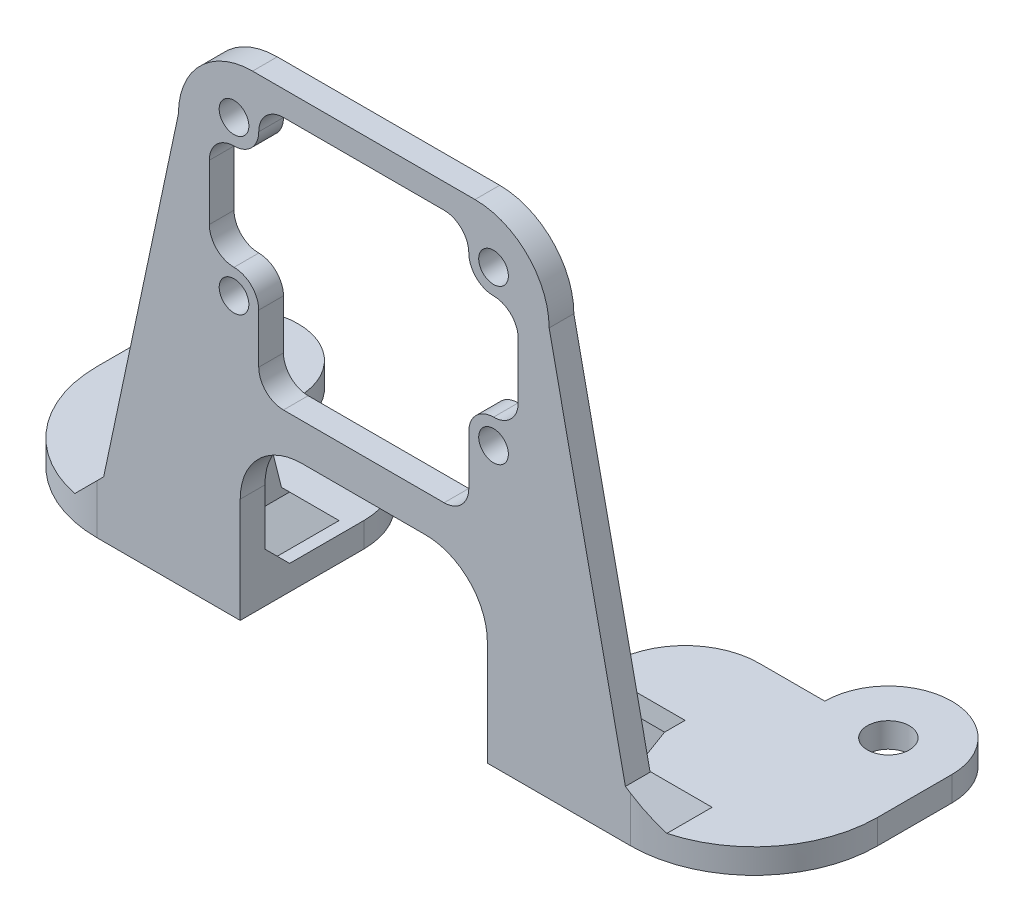
from build123d import *
from OCP.BRepFilletAPI import BRepFilletAPI_MakeChamfer

# Parameters (mm, degrees)
SKETCH1_R             = 1.7
BOSS_EXTRUDE1_DEPTH   = 2
SKETCH2_W             = 30
SKETCH2_H             = 2
BOSS_EXTRUDE2_DEPTH   = 35
CUT_EXTRUDE1_DEPTH    = 2
SKETCH5_W             = 17
SKETCH5_H             = 15.5
CUT_EXTRUDE2_DEPTH    = 2
SKETCH6_R             = 1.2
CUT_EXTRUDE3_DEPTH    = 2
BOSS_EXTRUDE4_START   = -2
SKETCH7_W             = 30
SKETCH7_H             = 2
BOSS_EXTRUDE4_DEPTH   = 2
SKETCH8_W             = 20
SKETCH8_H             = 3
CUT_EXTRUDE4_DEPTH    = 2
SKETCH9_W             = 17
SKETCH9_H             = 3
CUT_EXTRUDE5_DEPTH    = 2
SKETCH10_W            = 2
SKETCH10_H            = 20
BOSS_EXTRUDE5_DEPTH   = 5
CUT_EXTRUDE6_START    = -30
CUT_EXTRUDE6_DEPTH    = 30
FILLET1_R             = 10
SKETCH12_W            = 20
SKETCH12_H            = 18.563508327
CUT_EXTRUDE7_DEPTH    = 2
FILLET2_R             = 2
BOSS_EXTRUDE6_START   = -2
BOSS_EXTRUDE6_DEPTH   = 2
BOSS_EXTRUDE7_START   = -2
SKETCH14_W            = 21
SKETCH14_H            = 11.5
BOSS_EXTRUDE7_DEPTH   = 2
BOSS_EXTRUDE8_START   = -2
BOSS_EXTRUDE8_DEPTH   = 2
FILLET3_R             = 2
FILLET4_R             = 6
SKETCH16_W            = 20
SKETCH16_H            = 8.5
CUT_EXTRUDE8_DEPTH    = 2
FILLET5_R             = 5
CHAMFER1_SIZE         = 2
CHAMFER1_SIZE2        = 2.748737084
CHAMFER1_SIZE2_2      = 2.596624047
CHAMFER2_SIZE         = 1
CHAMFER2_EDGE_2_SIZE  = 1
CHAMFER2_EDGE_3_SIZE  = 1
CHAMFER2_EDGE_3_SIZE2 = 2.732050808
CHAMFER2_EDGE_4_SIZE  = 1
CHAMFER2_EDGE_4_SIZE2 = 2.732050808
FILLET6_R             = 6


# Some blends are built 0.0001 mm under size
with BuildPart() as part:
    # Sketch1 → Boss-Extrude1 (new body)
    with BuildSketch(Plane(origin=(0, 0, 0), x_dir=(1, 0, 0), z_dir=(0, 1, 0))):
        with BuildLine():
            Line((-21.310608918, 0), (21.310608918, 0))
            ThreePointArc((21.310608918, 0), (26.45, 5.139391082), (31.589391082, 0))
            Line((31.589391082, 0), (31.589391082, -16))
            Line((31.589391082, -16), (10, -16))
            Line((10, -16), (10, -10.526162893))
            Line((10, -10.526162893), (10, -3))
            Line((10, -3), (-10, -3))
            Line((-10, -3), (-10, -10.526162893))
            Line((-10, -10.526162893), (-10, -16))
            Line((-10, -16), (-31.589391082, -16))
            Line((-31.589391082, -16), (-31.589391082, 0))
            ThreePointArc((-31.589391082, 0), (-26.45, 5.139391082), (-21.310608918, 0))
        make_face()
        with Locations(Location((-26.45, 0, 0), (0, 0, 270))):
            Circle(SKETCH1_R, mode=Mode.SUBTRACT)
        with Locations(Location((26.45, 0, 0), (0, 0, 270))):
            Circle(SKETCH1_R, mode=Mode.SUBTRACT)
    extrude(amount=BOSS_EXTRUDE1_DEPTH)

    # Sketch2 → Boss-Extrude2 (add)
    with BuildSketch(Plane(origin=(0, 2, 0), x_dir=(1, 0, 0), z_dir=(0, 1, 0))):
        with Locations((0, -15)):
            Rectangle(SKETCH2_W, SKETCH2_H)
    extrude(amount=BOSS_EXTRUDE2_DEPTH)

    # Sketch4 → Cut-Extrude1 (cut)
    with BuildSketch(Plane.XY.offset(16)):
        with BuildLine():
            Line((-12.5, 33), (-12.5, 24.5))
            Line((-12.5, 24.5), (-10.5, 24.5))
            ThreePointArc((-10.5, 24.5), (-9.085786438, 23.914213562), (-8.5, 22.5))
            Line((-8.5, 22.5), (-8.5, 20.5))
            Line((-8.5, 20.5), (8.5, 20.5))
            Line((8.5, 20.5), (8.5, 22.5))
            ThreePointArc((8.5, 22.5), (9.085786438, 23.914213562), (10.5, 24.5))
            Line((10.5, 24.5), (12.5, 24.5))
            Line((12.5, 24.5), (12.5, 33))
            Line((12.5, 33), (10.5, 33))
            ThreePointArc((10.5, 33), (9.085786438, 33.585786438), (8.5, 35))
            Line((8.5, 35), (8.5, 37))
            Line((8.5, 37), (-8.5, 37))
            Line((-8.5, 37), (-8.5, 35))
            ThreePointArc((-8.5, 35), (-9.085786438, 33.585786438), (-10.5, 33))
            Line((-10.5, 33), (-12.5, 33))
        make_face()
    extrude(amount=-CUT_EXTRUDE1_DEPTH, mode=Mode.SUBTRACT)

    # Sketch5 → Cut-Extrude2 (cut)
    with BuildSketch(Plane.XY.offset(16)):
        with Locations((0, 12.75)):
            Rectangle(SKETCH5_W, SKETCH5_H)
    extrude(amount=-CUT_EXTRUDE2_DEPTH, mode=Mode.SUBTRACT)

    # Sketch6 → Cut-Extrude3 (cut)
    with BuildSketch(Plane.XY.offset(16)):
        with Locations((-10.5, 35)):
            Circle(SKETCH6_R)
        with Locations((10.5, 35)):
            Circle(SKETCH6_R)
        with Locations((-10.5, 22.5)):
            Circle(SKETCH6_R)
        with Locations((10.5, 22.5)):
            Circle(SKETCH6_R)
    extrude(amount=-CUT_EXTRUDE3_DEPTH, mode=Mode.SUBTRACT)

    # Sketch7 → Boss-Extrude4 (add)
    with BuildSketch(Plane.XY.offset(16).offset(BOSS_EXTRUDE4_START)):
        with Locations((0, 38)):
            Rectangle(SKETCH7_W, SKETCH7_H)
    extrude(amount=BOSS_EXTRUDE4_DEPTH)

    # Sketch8 → Cut-Extrude4 (cut)
    with BuildSketch(Plane(origin=(0, 2, 0), x_dir=(1, 0, 0), z_dir=(0, 1, 0))):
        with Locations((0, -1.5)):
            Rectangle(SKETCH8_W, SKETCH8_H)
    extrude(amount=-CUT_EXTRUDE4_DEPTH, mode=Mode.SUBTRACT)

    # Sketch9 → Cut-Extrude5 (cut)
    with BuildSketch(Plane.XY.offset(16)):
        with Locations((0, 3.5)):
            Rectangle(SKETCH9_W, SKETCH9_H)
    extrude(amount=-CUT_EXTRUDE5_DEPTH, mode=Mode.SUBTRACT)

    # Sketch10 → Boss-Extrude5 (add)
    with BuildSketch(Plane(origin=(0, 0, 14), x_dir=(-1, 0, 0), z_dir=(0, 0, -1))):
        with Locations((14, 12)):
            Rectangle(SKETCH10_W, SKETCH10_H)
        with Locations((-14, 12)):
            Rectangle(SKETCH10_W, SKETCH10_H)
    extrude(amount=BOSS_EXTRUDE5_DEPTH)

    # Sketch11 → Cut-Extrude6 (cut)
    with BuildSketch(Plane.ZY.offset(15).offset(CUT_EXTRUDE6_START)):
        Polygon((14, 22), (9, 2), (9, 22), align=None)
    extrude(amount=CUT_EXTRUDE6_DEPTH, mode=Mode.SUBTRACT)

    # Fillet1
    fillet1_edges = [part.edges().sort_by_distance(p)[0] for p in [
        (31.589391082, 1, 16),
        (-31.589391082, 1, 16),
    ]]
    fillet(fillet1_edges, radius=FILLET1_R)

    # Sketch12 → Cut-Extrude7 (cut)
    with BuildSketch(Plane.XY.offset(16)):
        with Locations((0, 11.281754164)):
            Rectangle(SKETCH12_W, SKETCH12_H)
    extrude(amount=-CUT_EXTRUDE7_DEPTH, mode=Mode.SUBTRACT)

    # Fillet2
    # the kernel refuses this fillet: 2 mm, written as the material it takes off along each edge
    with BuildSketch(Plane(origin=(8.5, 20.563508327, 9.158770817), x_dir=(0, 1, 0), z_dir=(0, 0, 1))) as fillet2_piece_1:
        with BuildLine():
            CenterArc((1.936491673, -2), FILLET2_R, 90, 75.522487814)
            Line((0, -1.5), (-0.038729833, -1.49))
            ThreePointArc((-0.038729833, -1.49), (-0.04, -0.75), (-0.04, 0))
            Line((-0.04, 0), (0, 0.04))
            Line((0, 0.04), (1.936491673, 0.04))
            Line((1.936491673, 0.04), (1.936491673, 0))
        make_face()
    extrude(amount=11.682458366, mode=Mode.SUBTRACT)
    with BuildSketch(Plane(origin=(-8.5, 20.563508327, 9.158770817), x_dir=(-1, 0, 0), z_dir=(0, 0, 1))) as fillet2_piece_2:
        with BuildLine():
            CenterArc((2, -1.936491673), FILLET2_R, 104.477512186, 75.522487814)
            Line((0, -1.936491673), (-0.04, -1.936491673))
            Line((-0.04, -1.936491673), (-0.04, 0))
            Line((-0.04, 0), (0, 0.04))
            ThreePointArc((0, 0.04), (0.75, 0.04), (1.49, 0.038729833))
            Line((1.49, 0.038729833), (1.5, 0))
        make_face()
    extrude(amount=11.682458366, mode=Mode.SUBTRACT)

    # Sketch13 → Boss-Extrude6 (add)
    with BuildSketch(Plane.XY.offset(16).offset(BOSS_EXTRUDE6_START)):
        Polygon((-15, 2), (-15, 33), (-21.589391082, 2), align=None)
        Polygon((21.589391082, 2), (15, 2), (15, 33), align=None)
    extrude(amount=BOSS_EXTRUDE6_DEPTH)

    # Sketch14 → Boss-Extrude7 (add)
    with BuildSketch(Plane.XY.offset(16).offset(BOSS_EXTRUDE7_START)):
        with Locations((0, 10.75)):
            Rectangle(SKETCH14_W, SKETCH14_H)
    extrude(amount=BOSS_EXTRUDE7_DEPTH)

    # Sketch15 → Boss-Extrude8 (add)
    with BuildSketch(Plane.XY.offset(16).offset(BOSS_EXTRUDE8_START)):
        with BuildLine():
            Line((-8.5, 22.5), (-8.5, 16.5))
            Line((-8.5, 16.5), (-10, 16.5))
            Line((-10, 16.5), (-10, 20.563508327))
            ThreePointArc((-10, 20.563508327), (-8.91886117, 21.275255129), (-8.5, 22.5))
        make_face()
        with BuildLine():
            Line((8.5, 22.5), (8.5, 16.5))
            Line((8.5, 16.5), (10, 16.5))
            Line((10, 16.5), (10, 20.563508327))
            ThreePointArc((10, 20.563508327), (8.91886117, 21.275255129), (8.5, 22.5))
        make_face()
    extrude(amount=BOSS_EXTRUDE8_DEPTH)

    # Fillet3
    fillet3_edges = [part.edges().sort_by_distance(p)[0] for p in [
        (-8.5, 16.5, 15),
        (8.5, 16.5, 15),
        (12.5, 24.5, 15),
        (-12.5, 24.5, 15),
        (12.5, 33, 15),
        (8.5, 37, 15),
        (-8.5, 37, 15),
        (-12.5, 33, 15),
    ]]
    fillet(fillet3_edges, radius=FILLET3_R - 0.0001)  # a hair under: the kernel refuses the full size

    # Fillet4
    fillet4_edges = [part.edges().sort_by_distance(p)[0] for p in [
        (15, 39, 15),
        (-15, 39, 15),
    ]]
    fillet(fillet4_edges, radius=FILLET4_R - 0.0001)  # a hair under: the kernel refuses the full size

    # Sketch16 → Cut-Extrude8 (cut)
    with BuildSketch(Plane.XY.offset(16)):
        with Locations((0, 9.25)):
            Rectangle(SKETCH16_W, SKETCH16_H)
    extrude(amount=-CUT_EXTRUDE8_DEPTH, mode=Mode.SUBTRACT)

    # Fillet5
    fillet5_edges = [part.edges().sort_by_distance(p)[0] for p in [
        (-10, 13.5, 15),
        (10, 13.5, 15),
    ]]
    fillet(fillet5_edges, radius=FILLET5_R)

    # Chamfer1: one chamfer whose edges measure the first distance from different faces: ONE call of the kernel's chamfer builder (chamfer() names one face for all edges)
    chamfer1_edges_1 = [part.edges().sort_by_distance(p)[0] for p in [
        (-13, 2, 11.5),
        (11.5, 2, 14),
        (13, 2, 11.5),
        (-18.294695541, 2, 14),
        (15, 2, 11.5),
        (18.294695541, 2, 14),
        (-11.5, 2, 14),
        (-15, 2, 11.5),
    ]]
    chamfer1_edges_2 = [part.edges().sort_by_distance(p)[0] for p in [
        (-14, 2, 9),
    ]]
    chamfer1_side_2 = [part.faces().sort_by_distance(p)[0] for p in [
        (-21.362181676, 2, 5.92457091),
    ]]
    chamfer1_edges_3 = [part.edges().sort_by_distance(p)[0] for p in [
        (14, 2, 9),
    ]]
    chamfer1_side_3 = [part.faces().sort_by_distance(p)[0] for p in [
        (21.362181676, 2, 5.92457091),
    ]]
    chamfer1_edges_4 = [part.edges().sort_by_distance(p)[0] for p in [
        (-21.589391082, 2, 15),
    ]]
    chamfer1_side_4 = [part.faces().sort_by_distance(p)[0] for p in [
        (-21.362181676, 2, 5.92457091),
    ]]
    chamfer1_edges_5 = [part.edges().sort_by_distance(p)[0] for p in [
        (21.589391082, 2, 15),
    ]]
    chamfer1_side_5 = [part.faces().sort_by_distance(p)[0] for p in [
        (18.294695541, 17.5, 15),
    ]]
    chamfer1 = BRepFilletAPI_MakeChamfer(part.part.solid().wrapped)
    for e in chamfer1_edges_1:
        chamfer1.Add(CHAMFER1_SIZE, e.wrapped)
    for e in chamfer1_edges_2:
        chamfer1.Add(CHAMFER1_SIZE, CHAMFER1_SIZE2, e.wrapped, chamfer1_side_2[0].wrapped)  # the first distance lies on this face
    for e in chamfer1_edges_3:
        chamfer1.Add(CHAMFER1_SIZE, CHAMFER1_SIZE2, e.wrapped, chamfer1_side_3[0].wrapped)  # the first distance lies on this face
    for e in chamfer1_edges_4:
        chamfer1.Add(CHAMFER1_SIZE, CHAMFER1_SIZE2_2, e.wrapped, chamfer1_side_4[0].wrapped)  # the first distance lies on this face
    for e in chamfer1_edges_5:
        chamfer1.Add(CHAMFER1_SIZE, CHAMFER1_SIZE2_2, e.wrapped, chamfer1_side_5[0].wrapped)  # the first distance lies on this face
    add(Compound.cast(chamfer1.Shape()), mode=Mode.REPLACE)

    # Chamfer2
    chamfer2_edges = [part.edges().sort_by_distance(p)[0] for p in [
        (15, 13, 14),
    ]]
    chamfer(chamfer2_edges, length=CHAMFER2_SIZE)

    # Chamfer2 edge 2
    chamfer2_edge_2_edges = [part.edges().sort_by_distance(p)[0] for p in [
        (-15, 13, 14),
    ]]
    chamfer(chamfer2_edge_2_edges, length=CHAMFER2_EDGE_2_SIZE)

    # Chamfer2 edge 3
    chamfer2_edge_3_edges = [part.edges().sort_by_distance(p)[0] for p in [
        (16, 3, 13),
    ]]
    chamfer2_edge_3_side = [part.faces().sort_by_distance(p)[0] for p in [
        (19.357625286, 2.973019207, 12.973019207),
    ]]
    chamfer(chamfer2_edge_3_edges, length=CHAMFER2_EDGE_3_SIZE, length2=CHAMFER2_EDGE_3_SIZE2, reference=chamfer2_edge_3_side[0])

    # Chamfer2 edge 4
    chamfer2_edge_4_edges = [part.edges().sort_by_distance(p)[0] for p in [
        (-16, 3, 13),
    ]]
    chamfer2_edge_4_side = [part.faces().sort_by_distance(p)[0] for p in [
        (-19.294695541, 3, 13),
    ]]
    chamfer(chamfer2_edge_4_edges, length=CHAMFER2_EDGE_4_SIZE, length2=CHAMFER2_EDGE_4_SIZE2, reference=chamfer2_edge_4_side[0])

    # Fillet6
    fillet6_edges = [part.edges().sort_by_distance(p)[0] for p in [
        (-10, 1, 0),
        (10, 1, 0),
    ]]
    fillet(fillet6_edges, radius=FILLET6_R)


solid = part.part
